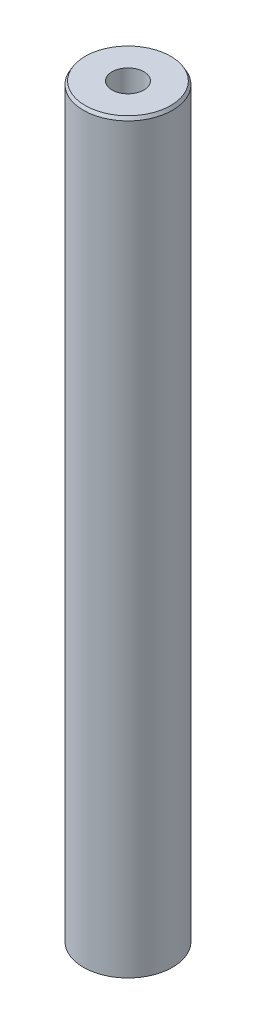
from build123d import *
from OCP.BRepFilletAPI import BRepFilletAPI_MakeChamfer

# Parameters (mm, degrees)
SKETCH1_R           = 25
BOSS_EXTRUDE1_DEPTH = 419.238946515
SKETCH2_R           = 8.919348934
CUT_EXTRUDE1_DEPTH  = 421.727101902
CHAMFER1_SIZE       = 1.787151364
CHAMFER1_SIZE2      = 1.031812321


with BuildPart() as part:
    # Sketch1 → Boss-Extrude1 (new body)
    with BuildSketch(Plane(origin=(0, 0, 0), x_dir=(1, 0, 0), z_dir=(0, 1, 0))):
        Circle(SKETCH1_R)
    extrude(amount=BOSS_EXTRUDE1_DEPTH)

    # Sketch2 → Cut-Extrude1 (cut, through all)
    with BuildSketch(Plane(origin=(0, 0, 0), x_dir=(1, 0, 0), z_dir=(0, 1, 0))):
        Circle(SKETCH2_R)
    extrude(amount=CUT_EXTRUDE1_DEPTH, mode=Mode.SUBTRACT)

    # Chamfer1: one chamfer whose edges measure the first distance from different faces: ONE call of the kernel's chamfer builder (chamfer() names one face for all edges)
    chamfer1_edges_1 = [part.edges().sort_by_distance(p)[0] for p in [
        (-25, 419.238946515, 0),
    ]]
    chamfer1_side_1 = [part.faces().sort_by_distance(p)[0] for p in [
        (-25, 209.619473257, 0),
    ]]
    chamfer1_edges_2 = [part.edges().sort_by_distance(p)[0] for p in [
        (-25, 0, 0),
    ]]
    chamfer1_side_2 = [part.faces().sort_by_distance(p)[0] for p in [
        (-24.292893219, 0, 0),
    ]]
    chamfer1 = BRepFilletAPI_MakeChamfer(part.part.solid().wrapped)
    for e in chamfer1_edges_1:
        chamfer1.Add(CHAMFER1_SIZE, CHAMFER1_SIZE2, e.wrapped, chamfer1_side_1[0].wrapped)  # the first distance lies on this face
    for e in chamfer1_edges_2:
        chamfer1.Add(CHAMFER1_SIZE, CHAMFER1_SIZE2, e.wrapped, chamfer1_side_2[0].wrapped)  # the first distance lies on this face
    add(Compound.cast(chamfer1.Shape()), mode=Mode.REPLACE)


solid = part.part
